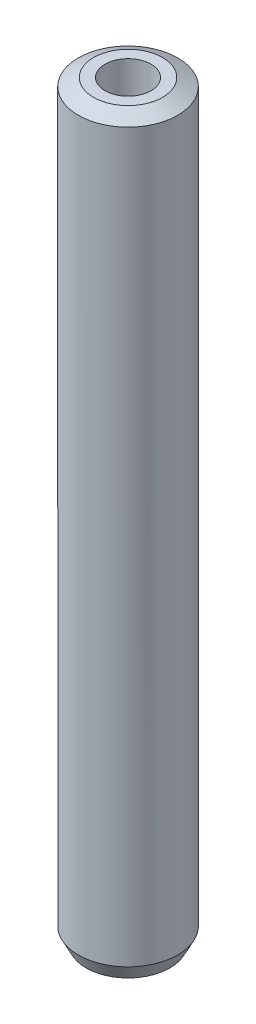
from build123d import *
from OCP.BRepFilletAPI import BRepFilletAPI_MakeChamfer

# Parameters (mm, degrees)
SKETCH1_R           = 25
BOSS_EXTRUDE1_DEPTH = 377.081839435
SKETCH2_R           = 11.57214503
CUT_EXTRUDE1_DEPTH  = 379.735677791
CHAMFER1_SIZE       = 3.969052585
CHAMFER1_SIZE2      = 7.662664307


with BuildPart() as part:
    # Sketch1 → Boss-Extrude1 (new body)
    with BuildSketch(Plane(origin=(0, 0, 0), x_dir=(1, 0, 0), z_dir=(0, 1, 0))):
        Circle(SKETCH1_R)
    extrude(amount=BOSS_EXTRUDE1_DEPTH)

    # Sketch2 → Cut-Extrude1 (cut, through all)
    with BuildSketch(Plane(origin=(0, 0, 0), x_dir=(1, 0, 0), z_dir=(0, 1, 0))):
        Circle(SKETCH2_R)
    extrude(amount=CUT_EXTRUDE1_DEPTH, mode=Mode.SUBTRACT)

    # Chamfer1: one chamfer whose edges measure the first distance from different faces: ONE call of the kernel's chamfer builder (chamfer() names one face for all edges)
    chamfer1_edges_1 = [part.edges().sort_by_distance(p)[0] for p in [
        (-25, 377.081839435, 0),
    ]]
    chamfer1_side_1 = [part.faces().sort_by_distance(p)[0] for p in [
        (-25, 188.540919717, 0),
    ]]
    chamfer1_edges_2 = [part.edges().sort_by_distance(p)[0] for p in [
        (-25, 0, 0),
    ]]
    chamfer1_side_2 = [part.faces().sort_by_distance(p)[0] for p in [
        (-24.292893219, 0, 0),
    ]]
    chamfer1 = BRepFilletAPI_MakeChamfer(part.part.solid().wrapped)
    for e in chamfer1_edges_1:
        chamfer1.Add(CHAMFER1_SIZE, CHAMFER1_SIZE2, e.wrapped, chamfer1_side_1[0].wrapped)  # the first distance lies on this face
    for e in chamfer1_edges_2:
        chamfer1.Add(CHAMFER1_SIZE, CHAMFER1_SIZE2, e.wrapped, chamfer1_side_2[0].wrapped)  # the first distance lies on this face
    add(Compound.cast(chamfer1.Shape()), mode=Mode.REPLACE)


solid = part.part
